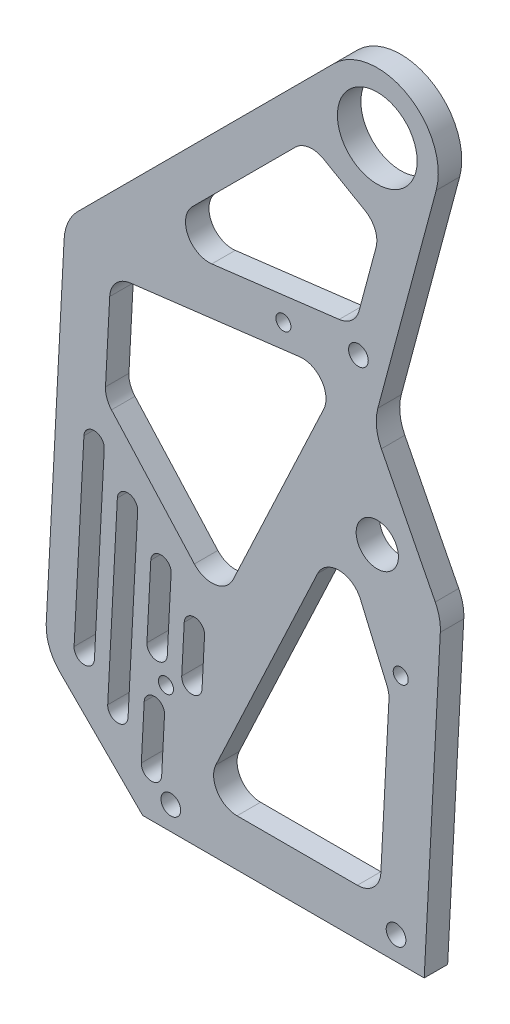
from build123d import *

# Parameters (mm, degrees)
SKETCH1_W           = 80
SKETCH1_H           = 180
SKETCH1_R           = 8.5
BOSS_EXTRUDE1_DEPTH = 5
SKETCH2_R           = 4.5
CUT_EXTRUDE1_DEPTH  = 30
SKETCH3_R           = 1.6
SKETCH3_R_2         = 2.5
CUT_EXTRUDE2_DEPTH  = 5
CUT_EXTRUDE3_DEPTH  = 10
BOSS_EXTRUDE2_DEPTH = 5
FILLET1_R           = 2
FILLET2_R           = 5
SKETCH6_R           = 2.1
CUT_EXTRUDE4_DEPTH  = 5
SKETCH7_W           = 60
SKETCH7_H           = 19.778044947
BOSS_EXTRUDE3_DEPTH = 5
SKETCH8_R           = 2.1
CUT_EXTRUDE6_DEPTH  = 5
CUT_EXTRUDE7_DEPTH  = 5
CUT_EXTRUDE8_DEPTH  = 10
FILLET3_R           = 5
FILLET4_R           = 3
BOSS_EXTRUDE4_DEPTH = 5
CUT_EXTRUDE9_DEPTH  = 5
BOSS_EXTRUDE5_DEPTH = 5
CUT_EXTRUDE10_DEPTH = 5
FILLET5_R           = 5
FILLET6_R           = 10


with BuildPart() as part:
    # Sketch1 → Boss-Extrude1 (new body)
    with BuildSketch(Plane.XY):
        with Locations((10, 166)):
            Rectangle(SKETCH1_W, SKETCH1_H)
        with Locations((20, 226)):
            Circle(SKETCH1_R, mode=Mode.SUBTRACT)
    extrude(amount=BOSS_EXTRUDE1_DEPTH)

    # Sketch2 → Cut-Extrude1 (cut)
    with BuildSketch(Plane.XY.offset(5)):
        with Locations((20, 151)):
            Circle(SKETCH2_R)
    extrude(amount=-CUT_EXTRUDE1_DEPTH, mode=Mode.SUBTRACT)

    # Sketch3 → Cut-Extrude2 (cut)
    with BuildSketch(Plane.XY.offset(5)):
        with Locations((0, 182)):
            Circle(SKETCH3_R)
        with Locations((25, 129.301270189)):
            Circle(SKETCH3_R)
        with Locations((-25.032859693, 102.533479235)):
            Circle(SKETCH3_R)
        with Locations((-15, 81)):
            Circle(SKETCH3_R_2)
        with Locations((15, 81)):
            Circle(SKETCH3_R_2)
        with Locations((24, 91)):
            Circle(SKETCH3_R_2)
        with Locations((-24, 91)):
            Circle(SKETCH3_R_2)
    extrude(amount=-CUT_EXTRUDE2_DEPTH, mode=Mode.SUBTRACT)

    # Sketch4 → Cut-Extrude3 (cut)
    with BuildSketch(Plane.XY.offset(5)):
        with BuildLine():
            Line((-30, 194.384776311), (10.807611845, 235.192388155))
            ThreePointArc((10.807611845, 235.192388155), (24.974884621, 238.010433923), (33, 226))
            ThreePointArc((33, 226), (32.888783198, 224.303159501), (32.557035742, 222.635352414))
            Line((32.557035742, 222.635352414), (22.786943589, 186.172872106))
            Line((22.786943589, 186.172872106), (30, 173.679491924))
            Line((30, 173.679491924), (30, 76))
            Line((30, 76), (50, 76))
            Line((50, 76), (50, 256))
            Line((50, 256), (-30, 256))
            Line((-30, 256), (-30, 194.384776311))
        make_face()
    extrude(amount=-CUT_EXTRUDE3_DEPTH, mode=Mode.SUBTRACT)

    # Sketch5 → Boss-Extrude2 (add)
    with BuildSketch(Plane.XY.offset(5)):
        with BuildLine():
            Line((-30, 169.384776311), (-30, 194.384776311))
            Line((-30, 194.384776311), (-46.535533906, 177.849242405))
            ThreePointArc((-46.535533906, 177.849242405), (-47.619397663, 176.227125661), (-48, 174.313708499))
            Line((-48, 174.313708499), (-48, 96.071067812))
            ThreePointArc((-48, 96.071067812), (-47.619397663, 94.15765065), (-46.535533906, 92.535533906))
            Line((-46.535533906, 92.535533906), (-30, 76))
            Line((-30, 76), (-30, 101))
            ThreePointArc((-30, 101), (-35, 96), (-40, 101))
            Line((-40, 101), (-40, 131.707106781))
            Line((-40, 131.707106781), (-30, 121.707106781))
            Line((-30, 121.707106781), (-30, 138.67766953))
            Line((-30, 138.67766953), (-40, 148.67766953))
            Line((-40, 148.67766953), (-40, 169.384776311))
            ThreePointArc((-40, 169.384776311), (-35, 174.384776311), (-30, 169.384776311))
        make_face()
    extrude(amount=-BOSS_EXTRUDE2_DEPTH)

    # Fillet1
    fillet1_edges = [part.edges().sort_by_distance(p)[0] for p in [
        (-40, 131.707106781, 2.5),
        (-40, 148.67766953, 2.5),
        (-30, 121.707106781, 2.5),
        (-30, 138.67766953, 2.5),
    ]]
    fillet(fillet1_edges, radius=FILLET1_R)

    # Fillet2
    fillet2_edges = [part.edges().sort_by_distance(p)[0] for p in [
        (30, 173.679491924, 2.5),
        (22.786943589, 186.172872106, 2.5),
    ]]
    fillet(fillet2_edges, radius=FILLET2_R)

    # Sketch6 → Cut-Extrude4 (cut)
    with BuildSketch(Plane.XY.offset(5)):
        with Locations((15.982125076, 183.959163508)):
            Circle(SKETCH6_R)
    extrude(amount=-CUT_EXTRUDE4_DEPTH, mode=Mode.SUBTRACT)

    # Sketch7 → Boss-Extrude3 (add)
    with BuildSketch(Plane.XY.offset(5)):
        with Locations((0, 85.889022474)):
            Rectangle(SKETCH7_W, SKETCH7_H)
    extrude(amount=-BOSS_EXTRUDE3_DEPTH)

    # Sketch8 → Cut-Extrude6 (cut)
    with BuildSketch(Plane.XY.offset(5)):
        with Locations((-24, 81)):
            Circle(SKETCH8_R)
        with Locations((24, 81)):
            Circle(SKETCH8_R)
    extrude(amount=-CUT_EXTRUDE6_DEPTH, mode=Mode.SUBTRACT)

    # Sketch9 → Cut-Extrude7 (cut)
    with BuildSketch(Plane.XY.offset(5)):
        with BuildLine():
            Line((18.046029168, 201.838654795), (15.618513493, 192.779042959))
            ThreePointArc((15.618513493, 192.779042959), (13.91917225, 190.174254019), (11.008699323, 189.077972384))
            Line((11.008699323, 189.077972384), (-9.794056189, 188.162535924))
            ThreePointArc((-9.794056189, 188.162535924), (-14.590082182, 191.143181287), (-13.549405056, 196.693235631))
            Line((-13.549405056, 196.693235631), (1.27739155, 211.520032237))
            ThreePointArc((1.27739155, 211.520032237), (4.701786886, 212.983263), (8.18783091, 211.673673466))
            ThreePointArc((8.18783091, 211.673673466), (11.25, 209.430341871), (14.723866695, 207.900091446))
            ThreePointArc((14.723866695, 207.900091446), (17.601026512, 205.53588353), (18.046029168, 201.838654795))
        make_face()
    extrude(amount=-CUT_EXTRUDE7_DEPTH, mode=Mode.SUBTRACT)

    # Sketch10 → Cut-Extrude8 (cut)
    with BuildSketch(Plane.XY.offset(5)):
        Polygon((-20, 175.052757164), (-20, 110.591633523), (16.036879799, 175.052757164), align=None)
        with BuildLine():
            Line((12.329553187, 143.829627228), (-20, 86))
            Line((-20, 86), (18, 86))
            Line((18, 86), (18, 140.692235936))
            ThreePointArc((18, 140.692235936), (14.916675161, 141.812518921), (12.329553187, 143.829627228))
        make_face()
    extrude(amount=-CUT_EXTRUDE8_DEPTH, mode=Mode.SUBTRACT)

    # Fillet3
    fillet3_edges = [part.edges().sort_by_distance(p)[0] for p in [
        (18, 86, 2.5),
        (-20, 86, 2.5),
        (-20, 110.591633523, 2.5),
        (16.036879799, 175.052757164, 2.5),
        (-20, 175.052757164, 2.5),
    ]]
    fillet(fillet3_edges, radius=FILLET3_R)

    # Fillet4
    fillet4_edges = [part.edges().sort_by_distance(p)[0] for p in [
        (18, 140.692235936, 2.5),
        (12.329553187, 143.829627228, 2.5),
    ]]
    fillet(fillet4_edges, radius=FILLET4_R)

    # Sketch11 → Boss-Extrude4 (add)
    with BuildSketch(Plane.XY.offset(5)):
        Polygon((33.573417682, 144.184871242), (30, 151.198098326), (30, 76), align=None)
        Polygon((-46.535533906, 92.535533906), (-46.535533906, 177.849242405), (-50.783984072, 96.783984072), align=None)
    extrude(amount=-BOSS_EXTRUDE4_DEPTH)

    # Sketch12 → Cut-Extrude9 (cut)
    with BuildSketch(Plane.XY.offset(5)):
        Polygon((-48, 149.905564689), (-46.535533906, 177.849242405), (-48, 176.384776311), align=None)
        Polygon((23.322975383, 188.173369993), (19.131176837, 172.529364848), (30, 151.198098326), (30, 213.092365109), align=None)
    extrude(amount=-CUT_EXTRUDE9_DEPTH, mode=Mode.SUBTRACT)

    # Sketch13 → Boss-Extrude5 (add)
    with BuildSketch(Plane.XY.offset(5)):
        with BuildLine():
            Line((-20, 86), (18, 86))
            Line((18, 86), (18, 140.692235936))
            ThreePointArc((18, 140.692235936), (14.916675161, 141.812518921), (12.329553187, 143.829627228))
            Line((12.329553187, 143.829627228), (-20, 86))
        make_face()
        Polygon((-20, 110.591633523), (16.036879799, 175.052757164), (-20, 175.052757164), align=None)
        with BuildLine():
            Line((-22.64564589, 187.596994797), (14.669985759, 189.239089265))
            Line((14.669985759, 189.239089265), (19.454274399, 207.094297548))
            ThreePointArc((19.454274399, 207.094297548), (11.25, 209.430341871), (5.124789072, 215.367429759))
            Line((5.124789072, 215.367429759), (-22.64564589, 187.596994797))
        make_face()
        with BuildLine():
            Line((-30, 169.384776311), (-30, 101))
            ThreePointArc((-30, 101), (-35, 96), (-40, 101))
            Line((-40, 101), (-40, 169.384776311))
            ThreePointArc((-40, 169.384776311), (-35, 174.384776311), (-30, 169.384776311))
        make_face()
    extrude(amount=-BOSS_EXTRUDE5_DEPTH)

    # Sketch14 → Cut-Extrude10 (cut)
    with BuildSketch(Plane.XY.offset(5)):
        Polygon((5.268411333, 218.339479145), (-29.670829152, 183.40023866), (15.236868274, 188.905233871), (20.731588667, 209.411809549), align=None)
        Polygon((-36.804726771, 172.450877341), (-38.029510766, 149.080606513), (-13.942803051, 122.329607483), (12.44563698, 178.488216865), align=None)
        Polygon((12.005757416, 149.335417367), (-17.755002002, 86), (20.510354333, 86), (22.548228221, 124.884950213), align=None)
        with BuildLine():
            Line((-38.186315677, 139.592100882), (-40.279753927, 99.646919491))
            ThreePointArc((-40.279753927, 99.646919491), (-42.560349042, 97.593462426), (-44.613806108, 99.874057541))
            Line((-44.613806108, 99.874057541), (-42.520367858, 139.819238932))
            ThreePointArc((-42.520367858, 139.819238932), (-40.239772743, 141.872695997), (-38.186315677, 139.592100882))
        make_face()
        with BuildLine():
            Line((-31.060725031, 131.678330734), (-33.114913535, 92.4820791))
            ThreePointArc((-33.114913535, 92.4820791), (-35.395508651, 90.428622034), (-37.448965716, 92.70921715))
            Line((-37.448965716, 92.70921715), (-35.394777212, 131.905468784))
            ThreePointArc((-35.394777212, 131.905468784), (-33.114182096, 133.95892585), (-31.060725031, 131.678330734))
        make_face()
        with BuildLine():
            Line((-25.340222207, 96.953887795), (-25.950073144, 85.317238708))
            ThreePointArc((-25.950073144, 85.317238708), (-28.230668259, 83.263781643), (-30.284125325, 85.544376758))
            Line((-30.284125325, 85.544376758), (-29.674274388, 97.181025845))
            ThreePointArc((-29.674274388, 97.181025845), (-27.393679272, 99.234482911), (-25.340222207, 96.953887795))
        make_face()
        with BuildLine():
            Line((-23.935134385, 123.764560587), (-24.755312324, 108.11463322))
            ThreePointArc((-24.755312324, 108.11463322), (-27.03590744, 106.061176154), (-29.089364505, 108.34177127))
            Line((-29.089364505, 108.34177127), (-28.269186566, 123.991698637))
            ThreePointArc((-28.269186566, 123.991698637), (-25.98859145, 126.045155703), (-23.935134385, 123.764560587))
        make_face()
        with BuildLine():
            Line((-16.809543739, 115.85079044), (-17.343381922, 105.664551097))
            ThreePointArc((-17.343381922, 105.664551097), (-19.623977037, 103.611094032), (-21.677434103, 105.891689147))
            Line((-21.677434103, 105.891689147), (-21.14359592, 116.07792849))
            ThreePointArc((-21.14359592, 116.07792849), (-18.863000804, 118.131385555), (-16.809543739, 115.85079044))
        make_face()
    extrude(amount=-CUT_EXTRUDE10_DEPTH, mode=Mode.SUBTRACT)

    # Fillet5
    fillet5_edges = [part.edges().sort_by_distance(p)[0] for p in [
        (12.005757416, 149.335417367, 2.5),
        (22.548228221, 124.884950213, 2.5),
        (-17.755002002, 86, 2.5),
        (20.510354333, 86, 2.5),
        (-13.942803051, 122.329607483, 2.5),
        (-38.029510766, 149.080606513, 2.5),
        (-36.804726771, 172.450877341, 2.5),
        (12.44563698, 178.488216865, 2.5),
        (15.236868274, 188.905233871, 2.5),
        (-29.670829152, 183.40023866, 2.5),
        (20.731588667, 209.411809549, 2.5),
        (5.268411333, 218.339479145, 2.5),
    ]]
    fillet(fillet5_edges, radius=FILLET5_R)

    # Fillet6
    fillet6_edges = [part.edges().sort_by_distance(p)[0] for p in [
        (-50.783984072, 96.783984072, 2.5),
        (-46.535533906, 177.849242405, 2.5),
        (33.573417682, 144.184871242, 2.5),
        (19.131176837, 172.529364848, 2.5),
    ]]
    fillet(fillet6_edges, radius=FILLET6_R)


solid = part.part
